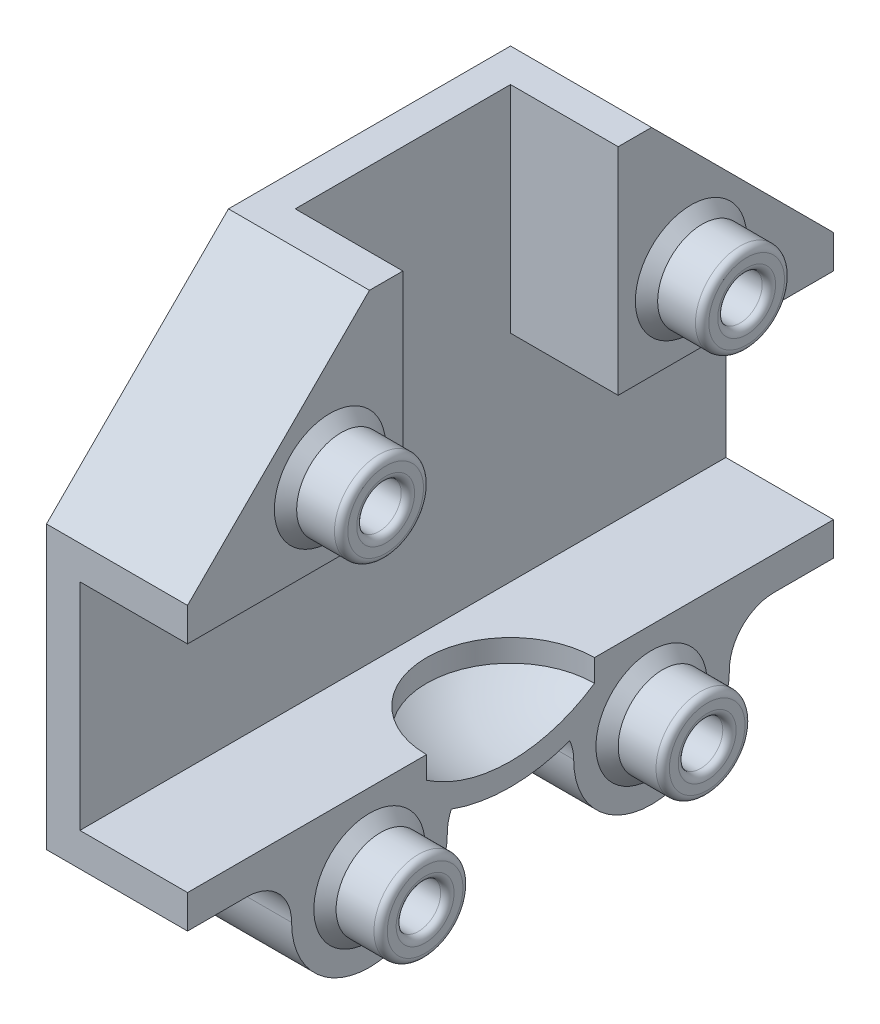
from build123d import *

# Parameters (mm, degrees)
BOSS_EXTRUDE1_DEPTH   = 9.675
SKETCH2_W             = 58.05
SKETCH2_H             = 3
BOSS_EXTRUDE1_2_DEPTH = 9.675
BOSS_EXTRUDE1_3_DEPTH = 9.675
BOSS_EXTRUDE2_DEPTH   = 3
BOSS_EXTRUDE3_DEPTH   = 12.675
SKETCH6_R             = 2
CUT_EXTRUDE1_DEPTH    = 43.959945007
SKETCH7_R             = 3
CUT_EXTRUDE3_DEPTH    = 11.175
BOSS_EXTRUDE4_START   = 5
SKETCH8_R             = 4
SKETCH8_R_2           = 2
BOSS_EXTRUDE4_DEPTH   = 5
CHAMFER1_SIZE         = 1
FILLET1_R             = 0.6
SKETCH10_R            = 7.55
CUT_EXTRUDE4_DEPTH    = 2
REVOLVE1_ANGLE        = 180


with BuildPart() as part:
    # Sketch2 → Boss-Extrude1 (new body)
    with BuildSketch(Plane(origin=(0, 0, 0), x_dir=(0, 0, -1), z_dir=(1, 0, 0))):
        Polygon((-29.025, 9.675), (-29.025, 12.675), (-12.675, 29.025), (-9.675, 29.025), (-9.675, 9.675), align=None)
    extrude(amount=-BOSS_EXTRUDE1_DEPTH)



with BuildPart() as body_2:
    # Sketch2 → Boss-Extrude1 2 (new body)
    with BuildSketch(Plane(origin=(0, 0, 0), x_dir=(0, 0, -1), z_dir=(1, 0, 0))):
        with Locations((0, -11.175)):
            Rectangle(SKETCH2_W, SKETCH2_H)
    extrude(amount=-BOSS_EXTRUDE1_2_DEPTH)


with BuildPart() as body_3:
    # Sketch2 → Boss-Extrude1 3 (new body)
    with BuildSketch(Plane(origin=(0, 0, 0), x_dir=(0, 0, -1), z_dir=(1, 0, 0))):
        Polygon((9.675, 29.025), (12.675, 29.025), (29.025, 12.675), (29.025, 9.675), (9.675, 9.675), align=None)
    extrude(amount=-BOSS_EXTRUDE1_3_DEPTH)


with BuildPart() as part_1:
    add(part.part)

    add(body_2.part)  # Boss-Extrude2 merges body 2

    add(body_3.part)  # Boss-Extrude2 merges body 3
    # Sketch3 → Boss-Extrude2 (add)
    with BuildSketch(Plane.ZY.offset(9.675)):
        Polygon((-29.025, 12.675), (-12.675, 29.025), (12.675, 29.025), (29.025, 12.675), (29.025, -12.675), (-29.025, -12.675), align=None)
    extrude(amount=BOSS_EXTRUDE2_DEPTH)

    # Sketch5 → Boss-Extrude3 (add)
    with BuildSketch(Plane(origin=(0, 0, 0), x_dir=(0, 0, -1), z_dir=(1, 0, 0))):
        with BuildLine():
            Line((-29.025, -12.675), (-23.675, -12.675))
            ThreePointArc((-23.675, -12.675), (-20.846572875, -13.846572875), (-19.675, -16.675))
            ThreePointArc((-19.675, -16.675), (-12.675, -23.675), (-5.675, -16.675))
            ThreePointArc((-5.675, -16.675), (-4.503427125, -13.846572875), (-1.675, -12.675))
            Line((-1.675, -12.675), (1.675, -12.675))
            ThreePointArc((1.675, -12.675), (4.503427125, -13.846572875), (5.675, -16.675))
            ThreePointArc((5.675, -16.675), (12.675, -23.675), (19.675, -16.675))
            ThreePointArc((19.675, -16.675), (20.846572875, -13.846572875), (23.675, -12.675))
            Line((23.675, -12.675), (29.025, -12.675))
            Line((29.025, -12.675), (29.025, -9.675))
            Line((29.025, -9.675), (-29.025, -9.675))
            Line((-29.025, -9.675), (-29.025, -12.675))
        make_face()
    extrude(amount=-BOSS_EXTRUDE3_DEPTH)

    # Sketch6 → Cut-Extrude1 (cut, through all)
    with BuildSketch(Plane(origin=(0, 0, 0), x_dir=(0, 0, -1), z_dir=(1, 0, 0))):
        with Locations((-12.675, -16.675)):
            Circle(SKETCH6_R)
        with Locations((12.675, -16.675)):
            Circle(SKETCH6_R)
        with Locations((-16.22116344, 16.22116344)):
            Circle(SKETCH6_R)
        with Locations(Location((16.22116344, 16.22116344, 0), (0, 0, 180))):
            Circle(SKETCH6_R)
    extrude(amount=-CUT_EXTRUDE1_DEPTH, mode=Mode.SUBTRACT)

    # Sketch7 → Cut-Extrude3 (cut)
    with BuildSketch(Plane.ZY.offset(12.675)):
        with Locations((-16.22116344, 16.22116344)):
            Circle(SKETCH7_R)
        with Locations((16.22116344, 16.22116344)):
            Circle(SKETCH7_R)
        with Locations((-12.675, -16.675)):
            Circle(SKETCH7_R)
        with Locations((12.675, -16.675)):
            Circle(SKETCH7_R)
    extrude(amount=-CUT_EXTRUDE3_DEPTH, mode=Mode.SUBTRACT)

    # Sketch8 → Boss-Extrude4 (add)
    # profile 1 of 4: a face of its own
    with BuildSketch(Plane(origin=(0, 0, 0), x_dir=(0, 0, -1), z_dir=(1, 0, 0)).offset(BOSS_EXTRUDE4_START)):
        with Locations(Location((-16.22116344, 16.22116344, 0), (0, 0, 180))):
            Circle(SKETCH8_R)
        with Locations((-16.22116344, 16.22116344)):
            Circle(SKETCH8_R_2, mode=Mode.SUBTRACT)
    # profile 2 of 4: a face of its own
    with BuildSketch(Plane(origin=(0, 0, 0), x_dir=(0, 0, -1), z_dir=(1, 0, 0)).offset(BOSS_EXTRUDE4_START)):
        with Locations(Location((16.22116344, 16.22116344, 0), (0, 0, 180))):
            Circle(SKETCH8_R)
        with Locations((16.22116344, 16.22116344)):
            Circle(SKETCH8_R_2, mode=Mode.SUBTRACT)
    # profile 3 of 4: a face of its own
    with BuildSketch(Plane(origin=(0, 0, 0), x_dir=(0, 0, -1), z_dir=(1, 0, 0)).offset(BOSS_EXTRUDE4_START)):
        with Locations((12.675, -16.675)):
            Circle(SKETCH8_R)
        with Locations((12.675, -16.675)):
            Circle(SKETCH8_R_2, mode=Mode.SUBTRACT)
    # profile 4 of 4: a face of its own
    with BuildSketch(Plane(origin=(0, 0, 0), x_dir=(0, 0, -1), z_dir=(1, 0, 0)).offset(BOSS_EXTRUDE4_START)):
        with Locations((-12.675, -16.675)):
            Circle(SKETCH8_R)
        with Locations((-12.675, -16.675)):
            Circle(SKETCH8_R_2, mode=Mode.SUBTRACT)
    extrude(amount=-BOSS_EXTRUDE4_DEPTH)

    # Chamfer1
    chamfer1_edges = [part_1.edges().sort_by_distance(p)[0] for p in [
        (0, 16.22116344, 12.22116344),
        (0, 16.22116344, -20.22116344),
        (0, -16.675, -8.675),
        (0, -16.675, 16.675),
    ]]
    chamfer(chamfer1_edges, length=CHAMFER1_SIZE)

    # Fillet1
    # the kernel refuses this fillet: 0.6 mm, written as the material it takes off along each edge
    with BuildSketch(Plane(origin=(5, 16.22116344, 16.22116344), x_dir=(0, 0, 1), z_dir=(0, 1, 0))) as fillet1_piece_1:
        with BuildLine():
            CenterArc((4 - FILLET1_R, -FILLET1_R), FILLET1_R, 0, 90)
            Line((4 - FILLET1_R, 0), (4, 0))
            Line((4, 0), (4, -FILLET1_R))
        make_face()
    revolve(axis=Axis((5, 16.22116344, 16.22116344), (1, 0, 0)), mode=Mode.SUBTRACT)
    with BuildSketch(Plane(origin=(5, 16.22116344, 16.22116344), x_dir=(0, 0, -1), z_dir=(0, -1, 0))) as fillet1_piece_2:
        with BuildLine():
            CenterArc((2 + FILLET1_R, -FILLET1_R), FILLET1_R, 90, 90)
            Line((2 + FILLET1_R, 0), (2, 0))
            Line((2, 0), (2, -FILLET1_R))
        make_face()
    revolve(axis=Axis((5, 16.22116344, 16.22116344), (1, 0, 0)), mode=Mode.SUBTRACT)
    with BuildSketch(Plane(origin=(5, 16.22116344, -16.22116344), x_dir=(0, 0, 1), z_dir=(0, 1, 0))) as fillet1_piece_3:
        with BuildLine():
            CenterArc((4 - FILLET1_R, -FILLET1_R), FILLET1_R, 0, 90)
            Line((4 - FILLET1_R, 0), (4, 0))
            Line((4, 0), (4, -FILLET1_R))
        make_face()
    revolve(axis=Axis((5, 16.22116344, -16.22116344), (1, 0, 0)), mode=Mode.SUBTRACT)
    with BuildSketch(Plane(origin=(5, 16.22116344, -16.22116344), x_dir=(0, 0, -1), z_dir=(0, -1, 0))) as fillet1_piece_4:
        with BuildLine():
            CenterArc((2 + FILLET1_R, -FILLET1_R), FILLET1_R, 90, 90)
            Line((2, -FILLET1_R), (2, 0))
            Line((2, 0), (2 + FILLET1_R, 0))
        make_face()
    revolve(axis=Axis((5, 16.22116344, -16.22116344), (1, 0, 0)), mode=Mode.SUBTRACT)
    with BuildSketch(Plane(origin=(5, -16.675, -12.675), x_dir=(0, 0, -1), z_dir=(0, -1, 0))) as fillet1_piece_5:
        with BuildLine():
            CenterArc((4 - FILLET1_R, -FILLET1_R), FILLET1_R, 0, 90)
            Line((4 - FILLET1_R, 0), (4, 0))
            Line((4, 0), (4, -FILLET1_R))
        make_face()
    revolve(axis=Axis((5, -16.675, -12.675), (1, 0, 0)), mode=Mode.SUBTRACT)
    with BuildSketch(Plane(origin=(5, -16.675, -12.675), x_dir=(0, 0, -1), z_dir=(0, -1, 0))) as fillet1_piece_6:
        with BuildLine():
            CenterArc((2 + FILLET1_R, -FILLET1_R), FILLET1_R, 90, 90)
            Line((2 + FILLET1_R, 0), (2, 0))
            Line((2, 0), (2, -FILLET1_R))
        make_face()
    revolve(axis=Axis((5, -16.675, -12.675), (1, 0, 0)), mode=Mode.SUBTRACT)
    with BuildSketch(Plane(origin=(5, -16.675, 12.675), x_dir=(0, 0, -1), z_dir=(0, -1, 0))) as fillet1_piece_7:
        with BuildLine():
            CenterArc((4 - FILLET1_R, -FILLET1_R), FILLET1_R, 0, 90)
            Line((4 - FILLET1_R, 0), (4, 0))
            Line((4, 0), (4, -FILLET1_R))
        make_face()
    revolve(axis=Axis((5, -16.675, 12.675), (1, 0, 0)), mode=Mode.SUBTRACT)
    with BuildSketch(Plane(origin=(5, -16.675, 12.675), x_dir=(0, 0, -1), z_dir=(0, -1, 0))) as fillet1_piece_8:
        with BuildLine():
            CenterArc((2 + FILLET1_R, -FILLET1_R), FILLET1_R, 90, 90)
            Line((2 + FILLET1_R, 0), (2, 0))
            Line((2, 0), (2, -FILLET1_R))
        make_face()
    revolve(axis=Axis((5, -16.675, 12.675), (1, 0, 0)), mode=Mode.SUBTRACT)

    # Sketch10 → Cut-Extrude4 (cut)
    with BuildSketch(Plane(origin=(0, -9.675, 0), x_dir=(1, 0, 0), z_dir=(0, 1, 0))):
        Circle(SKETCH10_R)
    extrude(amount=-CUT_EXTRUDE4_DEPTH, mode=Mode.SUBTRACT)

    # Sketch11 → Revolve1 (revolve)
    with BuildSketch(Plane(origin=(0, 0, 0), x_dir=(0, 0, -1), z_dir=(1, 0, 0))):
        with BuildLine():
            Line((0, -11.675), (0, -15.975))
            ThreePointArc((0, -15.975), (5.780568556, -14.860004257), (10.731723594, -11.675))
            Line((10.731723594, -11.675), (0, -11.675))
        make_face()
    revolve(axis=Axis((0, -11.675, 0), (0, 1, 0)), revolution_arc=REVOLVE1_ANGLE)

    # Sketch12 → Cut-Revolve1 (revolve, cut)
    with BuildSketch(Plane(origin=(0, 0, 0), x_dir=(0, 0, -1), z_dir=(1, 0, 0))):
        with BuildLine():
            Line((0, -13.975), (0, -11.675))
            Line((0, -11.675), (7.55, -11.675))
            ThreePointArc((7.55, -11.675), (3.946279894, -13.387244869), (0, -13.975))
        make_face()
    revolve(axis=Axis((0, -13.975, 0), (0, 1, 0)), mode=Mode.SUBTRACT)


solid = part_1.part
